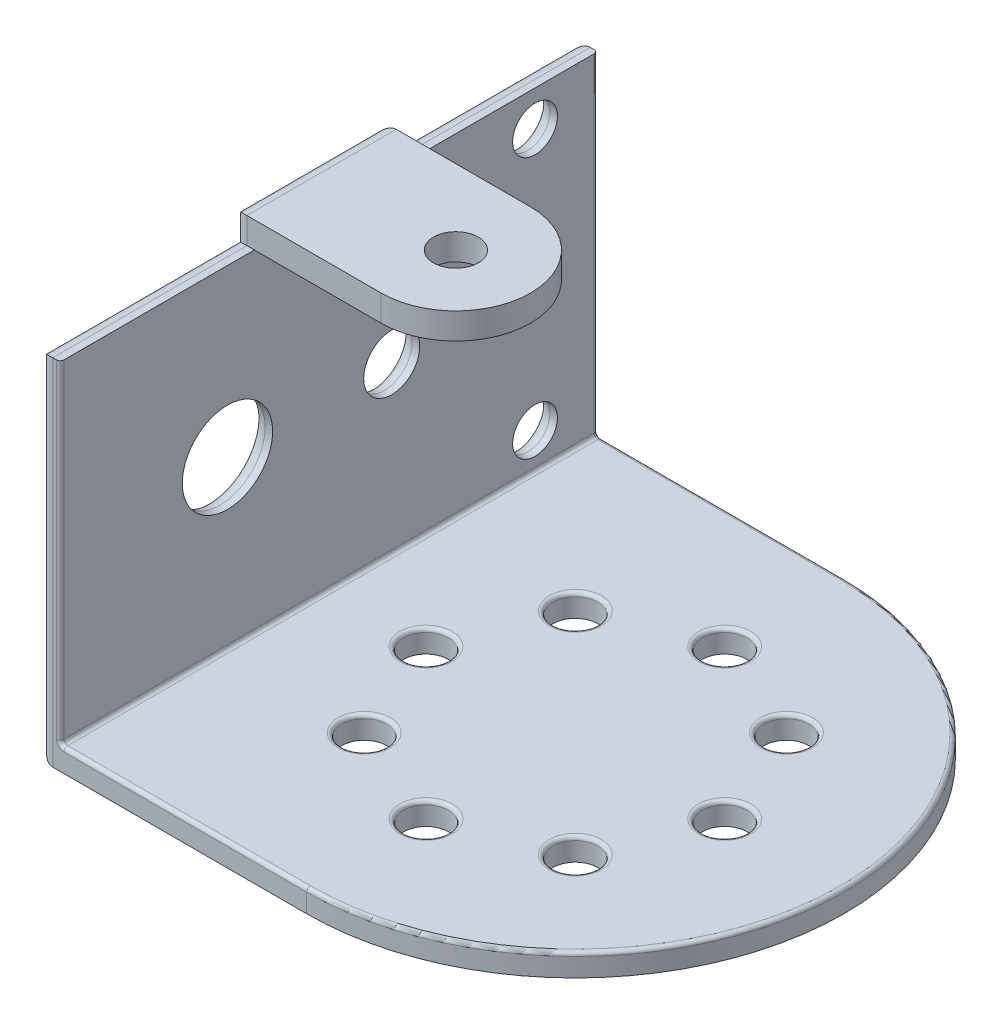
from build123d import *

# Parameters (mm, degrees)
CROQUIS1_W              = 36
CROQUIS1_H              = 22.25
CROQUIS1_R              = 1.5
CROQUIS1_R_2            = 3.025
CROQUIS1_R_3            = 1.875
SALIENTE_EXTRUIR1_DEPTH = 1.5
SALIENTE_EXTRUIR3_DEPTH = 1.5
SALIENTE_EXTRUIR4_DEPTH = 1.75
CORTAR_EXTRUIR1_REACH   = 49.647
CROQUIS5_R              = 1.5
CORTAR_EXTRUIR2_REACH   = 49.647
CROQUIS7_R              = 1.5
REDONDEO2_R             = 1
REDONDEO3_R             = 0.25


with BuildPart() as part:
    # Croquis1 → Saliente-Extruir1 (new body)
    with BuildSketch(Plane(origin=(0, 0, 0), x_dir=(0, 0, -1), z_dir=(1, 0, 0))):
        Rectangle(CROQUIS1_W, CROQUIS1_H)
        with Locations((13.8, 8.745)):
            Circle(CROQUIS1_R, mode=Mode.SUBTRACT)
        with Locations((-6.8, 0)):
            Circle(CROQUIS1_R_2, mode=Mode.SUBTRACT)
        with Locations(Location((13.8, -8.745, 0), (0, 0, 180))):
            Circle(CROQUIS1_R, mode=Mode.SUBTRACT)
        with Locations((4.2, 0)):
            Circle(CROQUIS1_R_3, mode=Mode.SUBTRACT)
    extrude(amount=SALIENTE_EXTRUIR1_DEPTH)

    # Croquis3<2> → Saliente-Extruir3 (add)
    with BuildSketch(Plane.XZ.offset(11.125)):
        with BuildLine():
            Line((18, -18), (0, -18))
            Line((0, -18), (0, 18))
            Line((0, 18), (18, 18))
            ThreePointArc((18, 18), (36, 0), (18, -18))
        make_face()
    extrude(amount=SALIENTE_EXTRUIR3_DEPTH)

    # Croquis4 → Saliente-Extruir4 (add)
    with BuildSketch(Plane(origin=(0, 11.125, 0), x_dir=(1, 0, 0), z_dir=(0, 1, 0))):
        with BuildLine():
            Line((10, 5), (0, 5))
            Line((0, 5), (0, -5))
            Line((0, -5), (10, -5))
            ThreePointArc((10, -5), (15, 0), (10, 5))
        make_face()
    extrude(amount=SALIENTE_EXTRUIR4_DEPTH)

    # Croquis5 → Cortar-Extruir1 (cut, up to next)
    with BuildSketch(Plane(origin=(0, 12.875, 0), x_dir=(1, 0, 0), z_dir=(0, 1, 0)), mode=Mode.PRIVATE) as cortar_extruir1_sk1:
        with Locations(Location((10, 0, 0), (0, 0, 270))):
            Circle(CROQUIS5_R)
    cortar_extruir1_tool1 = extrude(cortar_extruir1_sk1.sketch, amount=-CORTAR_EXTRUIR1_REACH, mode=Mode.PRIVATE) & part.part
    add(cortar_extruir1_tool1.solids().sort_by_distance((10, 12.875, 0))[0], mode=Mode.SUBTRACT)

    # Croquis7 → Cortar-Extruir2 (cut, up to next)
    with BuildSketch(Plane.XZ.offset(12.625), mode=Mode.PRIVATE) as cortar_extruir2_sk1:
        with Locations(Location((28, 0, 0), (0, 0, 270))):
            Circle(CROQUIS7_R)
    cortar_extruir2_tool1 = extrude(cortar_extruir2_sk1.sketch, amount=-CORTAR_EXTRUIR2_REACH, mode=Mode.PRIVATE) & part.part
    # Croquis7 → Cortar-Extruir2 (cut, up to next)
    with BuildSketch(Plane.XZ.offset(12.625), mode=Mode.PRIVATE) as cortar_extruir2_sk2:
        with Locations(Location((25.071067812, -7.071067812, 0), (0, 0, 270))):
            Circle(CROQUIS7_R)
    cortar_extruir2_tool2 = extrude(cortar_extruir2_sk2.sketch, amount=-CORTAR_EXTRUIR2_REACH, mode=Mode.PRIVATE) & part.part
    # Croquis7 → Cortar-Extruir2 (cut, up to next)
    with BuildSketch(Plane.XZ.offset(12.625), mode=Mode.PRIVATE) as cortar_extruir2_sk3:
        with Locations(Location((18, -10, 0), (0, 0, 270))):
            Circle(CROQUIS7_R)
    cortar_extruir2_tool3 = extrude(cortar_extruir2_sk3.sketch, amount=-CORTAR_EXTRUIR2_REACH, mode=Mode.PRIVATE) & part.part
    # Croquis7 → Cortar-Extruir2 (cut, up to next)
    with BuildSketch(Plane.XZ.offset(12.625), mode=Mode.PRIVATE) as cortar_extruir2_sk4:
        with Locations(Location((10.928932188, -7.071067812, 0), (0, 0, 270))):
            Circle(CROQUIS7_R)
    cortar_extruir2_tool4 = extrude(cortar_extruir2_sk4.sketch, amount=-CORTAR_EXTRUIR2_REACH, mode=Mode.PRIVATE) & part.part
    # Croquis7 → Cortar-Extruir2 (cut, up to next)
    with BuildSketch(Plane.XZ.offset(12.625), mode=Mode.PRIVATE) as cortar_extruir2_sk5:
        with Locations(Location((8, 0, 0), (0, 0, 270))):
            Circle(CROQUIS7_R)
    cortar_extruir2_tool5 = extrude(cortar_extruir2_sk5.sketch, amount=-CORTAR_EXTRUIR2_REACH, mode=Mode.PRIVATE) & part.part
    # Croquis7 → Cortar-Extruir2 (cut, up to next)
    with BuildSketch(Plane.XZ.offset(12.625), mode=Mode.PRIVATE) as cortar_extruir2_sk6:
        with Locations(Location((10.928932188, 7.071067812, 0), (0, 0, 270))):
            Circle(CROQUIS7_R)
    cortar_extruir2_tool6 = extrude(cortar_extruir2_sk6.sketch, amount=-CORTAR_EXTRUIR2_REACH, mode=Mode.PRIVATE) & part.part
    # Croquis7 → Cortar-Extruir2 (cut, up to next)
    with BuildSketch(Plane.XZ.offset(12.625), mode=Mode.PRIVATE) as cortar_extruir2_sk7:
        with Locations(Location((18, 10, 0), (0, 0, 270))):
            Circle(CROQUIS7_R)
    cortar_extruir2_tool7 = extrude(cortar_extruir2_sk7.sketch, amount=-CORTAR_EXTRUIR2_REACH, mode=Mode.PRIVATE) & part.part
    # Croquis7 → Cortar-Extruir2 (cut, up to next)
    with BuildSketch(Plane.XZ.offset(12.625), mode=Mode.PRIVATE) as cortar_extruir2_sk8:
        with Locations(Location((25.071067812, 7.071067812, 0), (0, 0, 270))):
            Circle(CROQUIS7_R)
    cortar_extruir2_tool8 = extrude(cortar_extruir2_sk8.sketch, amount=-CORTAR_EXTRUIR2_REACH, mode=Mode.PRIVATE) & part.part
    add(cortar_extruir2_tool1.solids().sort_by_distance((28, -12.625, 0))[0], mode=Mode.SUBTRACT)
    add(cortar_extruir2_tool2.solids().sort_by_distance((25.071068, -12.625, -7.071068))[0], mode=Mode.SUBTRACT)
    add(cortar_extruir2_tool3.solids().sort_by_distance((18, -12.625, -10))[0], mode=Mode.SUBTRACT)
    add(cortar_extruir2_tool4.solids().sort_by_distance((10.928932, -12.625, -7.071068))[0], mode=Mode.SUBTRACT)
    add(cortar_extruir2_tool5.solids().sort_by_distance((8, -12.625, 0))[0], mode=Mode.SUBTRACT)
    add(cortar_extruir2_tool6.solids().sort_by_distance((10.928932, -12.625, 7.071068))[0], mode=Mode.SUBTRACT)
    add(cortar_extruir2_tool7.solids().sort_by_distance((18, -12.625, 10))[0], mode=Mode.SUBTRACT)
    add(cortar_extruir2_tool8.solids().sort_by_distance((25.071068, -12.625, 7.071068))[0], mode=Mode.SUBTRACT)

    # Redondeo2
    # the kernel refuses this fillet: 1 mm, written as the material it takes off along each edge
    with BuildSketch(Plane(origin=(0, 8.745, -13.8), x_dir=(0, 0, -1), z_dir=(0, -1, 0))) as redondeo2_piece_1:
        with BuildLine():
            CenterArc((1.5 + REDONDEO2_R, REDONDEO2_R), REDONDEO2_R, 180, 90)
            Line((1.5, REDONDEO2_R), (1.5, 0))
            Line((1.5, 0), (1.5 + REDONDEO2_R, 0))
        make_face()
    revolve(axis=Axis((0, 8.745, -13.8), (1, 0, 0)), mode=Mode.SUBTRACT)
    with BuildSketch(Plane(origin=(0, 0, 6.8), x_dir=(0, 0, -1), z_dir=(0, -1, 0))) as redondeo2_piece_2:
        with BuildLine():
            CenterArc((3.025 + REDONDEO2_R, REDONDEO2_R), REDONDEO2_R, 180, 90)
            Line((3.025, REDONDEO2_R), (3.025, 0))
            Line((3.025, 0), (3.025 + REDONDEO2_R, 0))
        make_face()
    revolve(axis=Axis((0, 0, 6.8), (1, 0, 0)), mode=Mode.SUBTRACT)
    with BuildSketch(Plane(origin=(0, -8.745, -13.8), x_dir=(0, 0, 1), z_dir=(0, 1, 0))) as redondeo2_piece_3:
        with BuildLine():
            CenterArc((1.5 + REDONDEO2_R, REDONDEO2_R), REDONDEO2_R, 180, 90)
            Line((1.5, REDONDEO2_R), (1.5, 0))
            Line((1.5, 0), (1.5 + REDONDEO2_R, 0))
        make_face()
    revolve(axis=Axis((0, -8.745, -13.8), (1, 0, 0)), mode=Mode.SUBTRACT)
    with BuildSketch(Plane(origin=(0, 0, -4.2), x_dir=(0, 0, -1), z_dir=(0, -1, 0))) as redondeo2_piece_4:
        with BuildLine():
            CenterArc((1.875 + REDONDEO2_R, REDONDEO2_R), REDONDEO2_R, 180, 90)
            Line((1.875, REDONDEO2_R), (1.875, 0))
            Line((1.875, 0), (1.875 + REDONDEO2_R, 0))
        make_face()
    revolve(axis=Axis((0, 0, -4.2), (1, 0, 0)), mode=Mode.SUBTRACT)
    with BuildSketch(Plane(origin=(0, -12.625, -20.5), x_dir=(0, 1, 0), z_dir=(0, 0, 1))) as redondeo2_piece_5:
        with BuildLine():
            CenterArc((REDONDEO2_R, -REDONDEO2_R), REDONDEO2_R, 90, 90)
            Line((0, -REDONDEO2_R), (0, 0))
            Line((0, 0), (REDONDEO2_R, 0))
        make_face()
    extrude(amount=41, mode=Mode.SUBTRACT)
    with BuildSketch(Plane(origin=(0, 11.125, 5), x_dir=(0, -1, 0), z_dir=(0, 0, 1))) as redondeo2_piece_6:
        with BuildLine():
            CenterArc((REDONDEO2_R, REDONDEO2_R), REDONDEO2_R, 180, 90)
            Line((0, REDONDEO2_R), (0, 0))
            Line((0, 0), (REDONDEO2_R, 0))
        make_face()
    extrude(amount=15.5, mode=Mode.SUBTRACT)
    with BuildSketch(Plane(origin=(0, 11.125, -5), x_dir=(0, 0, 1), z_dir=(0, 1, 0))) as redondeo2_piece_7:
        with BuildLine():
            CenterArc((REDONDEO2_R, REDONDEO2_R), REDONDEO2_R, 180, 90)
            Line((0, REDONDEO2_R), (0, 0))
            Line((0, 0), (REDONDEO2_R, 0))
        make_face()
    extrude(amount=4.25, mode=Mode.SUBTRACT)
    with BuildSketch(Plane(origin=(0, 11.125, 5), x_dir=(0, 0, -1), z_dir=(0, 1, 0))) as redondeo2_piece_8:
        with BuildLine():
            CenterArc((REDONDEO2_R, -REDONDEO2_R), REDONDEO2_R, 90, 90)
            Line((0, -REDONDEO2_R), (0, 0))
            Line((0, 0), (REDONDEO2_R, 0))
        make_face()
    extrude(amount=4.25, mode=Mode.SUBTRACT)
    with BuildSketch(Plane(origin=(0, 12.875, -7.5), x_dir=(0, -1, 0), z_dir=(0, 0, 1))) as redondeo2_piece_9:
        with BuildLine():
            CenterArc((REDONDEO2_R, REDONDEO2_R), REDONDEO2_R, 180, 90)
            Line((0, REDONDEO2_R), (0, 0))
            Line((0, 0), (REDONDEO2_R, 0))
        make_face()
    extrude(amount=15, mode=Mode.SUBTRACT)
    with BuildSketch(Plane(origin=(0, -15.125, 18), x_dir=(0, 0, -1), z_dir=(0, 1, 0)), Plane(origin=(0, -15.125, -18), x_dir=(1, 0, 0), z_dir=(0, 1, 0))) as redondeo2_piece_10:
        with BuildLine():
            CenterArc((REDONDEO2_R, -REDONDEO2_R), REDONDEO2_R, 90, 90)
            Line((0, -REDONDEO2_R), (0, 0))
            Line((0, 0), (REDONDEO2_R, 0))
        make_face()
    extrude(amount=28.75, mode=Mode.SUBTRACT)
    with BuildSketch(Plane(origin=(0, 11.125, -20.5), x_dir=(1, 0, 0), z_dir=(0, 0, 1))) as redondeo2_piece_11:
        with BuildLine():
            CenterArc((REDONDEO2_R, -REDONDEO2_R), REDONDEO2_R, 90, 90)
            Line((0, -REDONDEO2_R), (0, 0))
            Line((0, 0), (REDONDEO2_R, 0))
        make_face()
    extrude(amount=15.5, mode=Mode.SUBTRACT)
    with BuildSketch(Plane(origin=(0, 8.625, 5), x_dir=(0, 0, -1), z_dir=(0, 1, 0))) as redondeo2_piece_12a_section:
        with BuildLine():
            CenterArc((REDONDEO2_R, -REDONDEO2_R), REDONDEO2_R, 90, 90)
            Line((0, -REDONDEO2_R), (0, 0))
            Line((0, 0), (REDONDEO2_R, 0))
        make_face()
    redondeo2_piece_12a = extrude(amount=6.75, mode=Mode.PRIVATE)
    redondeo2_piece_12a = split(redondeo2_piece_12a, bisect_by=Plane(origin=(0.226395114, 11.125, 4.773604886), z_dir=(0, -1, 0)), keep=Keep.TOP, mode=Mode.PRIVATE)
    with BuildSketch(Plane(origin=(0, 11.125, 2.5), x_dir=(0, -1, 0), z_dir=(0, 0, 1))) as redondeo2_piece_12b_section:
        with BuildLine():
            CenterArc((REDONDEO2_R, REDONDEO2_R), REDONDEO2_R, 180, 90)
            Line((0, REDONDEO2_R), (0, 0))
            Line((0, 0), (REDONDEO2_R, 0))
        make_face()
    redondeo2_piece_12b = extrude(amount=18, mode=Mode.PRIVATE)
    redondeo2_piece_12b = split(redondeo2_piece_12b, bisect_by=Plane(origin=(0.226395114, 10.898604886, 5), z_dir=(0, 0, -1)), keep=Keep.TOP, mode=Mode.PRIVATE)
    redondeo2_piece_12 = redondeo2_piece_12a & redondeo2_piece_12b
    add(redondeo2_piece_12, mode=Mode.SUBTRACT)
    with BuildSketch(Plane(origin=(0, 11.125, -20.5), x_dir=(1, 0, 0), z_dir=(0, 0, 1))) as redondeo2_piece_13a_section:
        with BuildLine():
            CenterArc((REDONDEO2_R, -REDONDEO2_R), REDONDEO2_R, 90, 90)
            Line((0, -REDONDEO2_R), (0, 0))
            Line((0, 0), (REDONDEO2_R, 0))
        make_face()
    redondeo2_piece_13a = extrude(amount=18, mode=Mode.PRIVATE)
    redondeo2_piece_13a = split(redondeo2_piece_13a, bisect_by=Plane(origin=(0.226395114, 10.898604886, -5), z_dir=(0, 0, 1)), keep=Keep.TOP, mode=Mode.PRIVATE)
    with BuildSketch(Plane(origin=(0, 8.625, -5), x_dir=(0, 0, 1), z_dir=(0, 1, 0))) as redondeo2_piece_13b_section:
        with BuildLine():
            CenterArc((REDONDEO2_R, REDONDEO2_R), REDONDEO2_R, 180, 90)
            Line((0, REDONDEO2_R), (0, 0))
            Line((0, 0), (REDONDEO2_R, 0))
        make_face()
    redondeo2_piece_13b = extrude(amount=6.75, mode=Mode.PRIVATE)
    redondeo2_piece_13b = split(redondeo2_piece_13b, bisect_by=Plane(origin=(0.226395114, 11.125, -4.773604886), z_dir=(0, -1, 0)), keep=Keep.TOP, mode=Mode.PRIVATE)
    redondeo2_piece_13 = redondeo2_piece_13a & redondeo2_piece_13b
    add(redondeo2_piece_13, mode=Mode.SUBTRACT)

    # Redondeo3
    redondeo3_edges = [part.edges().sort_by_distance(p)[0] for p in [
        (1.5, 0, 18),
        (1.5, -11.125, 0),
        (36, -11.125, 0),
        (9.75, -11.125, 18),
        (9.75, -11.125, -18),
        (1.5, 0, -18),
        (25.071067812, -11.125, 8.571067812),
        (18, -11.125, 11.5),
        (10.928932188, -11.125, 8.571067812),
        (8, -11.125, 1.5),
        (10.928932188, -11.125, -5.571067812),
        (18, -11.125, -8.5),
        (25.071067812, -11.125, -5.571067812),
        (28, -11.125, 1.5),
    ]]
    fillet(redondeo3_edges, radius=REDONDEO3_R)


solid = part.part
